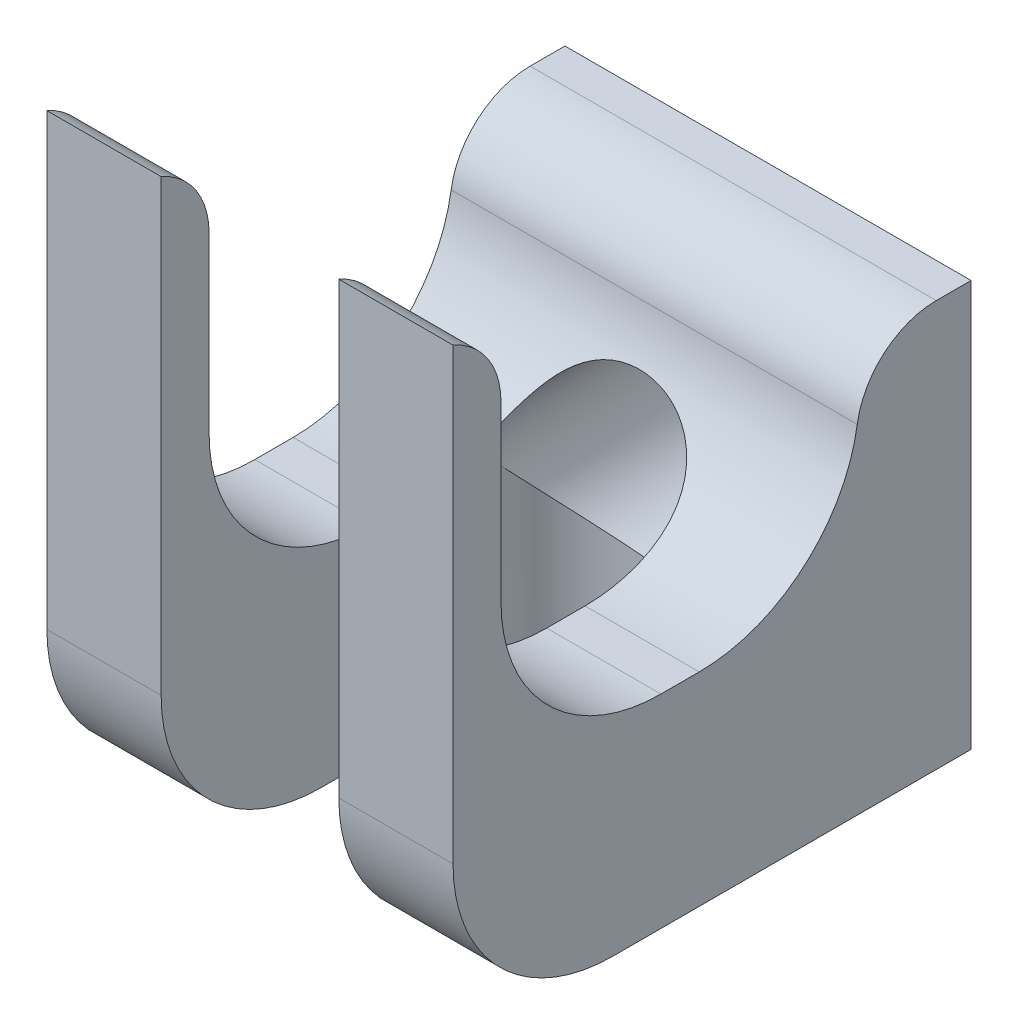
from build123d import *

# Parameters (mm, degrees)
SKETCH1_W                                        = 25.4
SKETCH1_H                                        = 25.4
BOSS_EXTRUDE1_DEPTH                              = 7
CBORE_FOR_1_4_SOCKET_HEAD_CAP_SCREW1_D           = 6.7564
CBORE_FOR_1_4_SOCKET_HEAD_CAP_SCREW1_CBORE_D     = 11.1125
CBORE_FOR_1_4_SOCKET_HEAD_CAP_SCREW1_CBORE_DEPTH = 6.35
SKETCH4_W                                        = 7.14375
SKETCH4_H                                        = 12.7
BOSS_EXTRUDE2_DEPTH                              = 25.4
SKETCH5_W                                        = 7.14375
SKETCH5_H                                        = 3
BOSS_EXTRUDE3_DEPTH                              = 25.4
FILLET1_R                                        = 10
FILLET2_START                                    = -14
FILLET2_DEPTH                                    = 28
FILLET2_START_2                                  = -12.7
FILLET2_2_DEPTH                                  = 12.604348727
FILLET2_START_3                                  = 7
FILLET2_3_DEPTH                                  = 10.0000001


with BuildPart() as part:
    # Sketch1 → Boss-Extrude1 (new body)
    with BuildSketch(Plane.XY):
        Rectangle(SKETCH1_W, SKETCH1_H)
    extrude(amount=BOSS_EXTRUDE1_DEPTH)

    # CBORE for 1/4 Socket Head Cap Screw1 (through all)
    with Locations(Plane.XY.offset(7)):
        with Locations((0, 0)):
            CounterBoreHole(CBORE_FOR_1_4_SOCKET_HEAD_CAP_SCREW1_D / 2, CBORE_FOR_1_4_SOCKET_HEAD_CAP_SCREW1_CBORE_D / 2, CBORE_FOR_1_4_SOCKET_HEAD_CAP_SCREW1_CBORE_DEPTH)

    # Sketch4 → Boss-Extrude2 (add)
    with BuildSketch(Plane.XY.offset(7)):
        with Locations((-9.128125, -6.35)):
            Rectangle(SKETCH4_W, SKETCH4_H)
        with Locations((9.128125, -6.35)):
            Rectangle(SKETCH4_W, SKETCH4_H)
    extrude(amount=BOSS_EXTRUDE2_DEPTH)

    # Sketch5 → Boss-Extrude3 (add)
    with BuildSketch(Plane(origin=(0, 0, 0), x_dir=(1, 0, 0), z_dir=(0, 1, 0))):
        with Locations((-9.128125, -30.9)):
            Rectangle(SKETCH5_W, SKETCH5_H)
        with Locations((9.128125, -30.9)):
            Rectangle(SKETCH5_W, SKETCH5_H)
    extrude(amount=BOSS_EXTRUDE3_DEPTH)

    # Fillet1
    # the kernel refuses this fillet: 10 mm, written as the material it adds along each edge
    with BuildSketch(Plane(origin=(-19.44375, 0, 7), x_dir=(0, 1, 0), z_dir=(1, 0, 0))) as fillet1_piece_1_section:
        with BuildLine():
            CenterArc((FILLET1_R, FILLET1_R), FILLET1_R, 180, 90)
            Line((0, FILLET1_R), (0, 0))
            Line((0, 0), (FILLET1_R, 0))
        make_face()
    fillet1_piece_1 = extrude(amount=32.14375, mode=Mode.PRIVATE)
    fillet1_piece_1 = fillet1_piece_1 - Plane(origin=(0, 0, 7), x_dir=(1, 0, 0), z_dir=(0, 0, 1)) * Cylinder(5.55625, 105, mode=Mode.PRIVATE)
    fillet1_piece_1 = split(fillet1_piece_1, bisect_by=Plane(origin=(-12.7, 0, 7), z_dir=(1, 0, 0)), keep=Keep.TOP, mode=Mode.PRIVATE)
    add(fillet1_piece_1)
    with BuildSketch(Plane(origin=(-12.7, 0, 29.4), x_dir=(0, 0, -1), z_dir=(1, 0, 0))) as fillet1_piece_2:
        with BuildLine():
            CenterArc((FILLET1_R, FILLET1_R), FILLET1_R, 180, 90)
            Line((0, FILLET1_R), (0, 0))
            Line((0, 0), (FILLET1_R, 0))
        make_face()
    extrude(amount=7.14375)
    with BuildSketch(Plane(origin=(-37.7, 0, 29.4), x_dir=(0, 0, -1), z_dir=(1, 0, 0))) as fillet1_piece_3_section:
        with BuildLine():
            CenterArc((FILLET1_R, FILLET1_R), FILLET1_R, 180, 90)
            Line((0, FILLET1_R), (0, 0))
            Line((0, 0), (FILLET1_R, 0))
        make_face()
    fillet1_piece_3 = extrude(amount=57.14375, mode=Mode.PRIVATE)
    fillet1_piece_3 = split(fillet1_piece_3, bisect_by=Plane(origin=(5.55625, 0, 29.4), z_dir=(1, 0, 0)), keep=Keep.TOP, mode=Mode.PRIVATE)
    fillet1_piece_3 = split(fillet1_piece_3, bisect_by=Plane(origin=(12.7, 0, 29.4), z_dir=(-1, 0, 0)), keep=Keep.TOP, mode=Mode.PRIVATE)
    add(fillet1_piece_3)
    with BuildSketch(Plane(origin=(12.7, 0, 29.4), x_dir=(0, 0, -1), z_dir=(-1, 0, 0))) as fillet1_piece_4:
        with BuildLine():
            CenterArc((FILLET1_R, -FILLET1_R), FILLET1_R, 90, 90)
            Line((0, -FILLET1_R), (0, 0))
            Line((0, 0), (FILLET1_R, 0))
        make_face()
    extrude(amount=7.14375)
    with BuildSketch(Plane(origin=(37.7, 0, 29.4), x_dir=(0, 0, -1), z_dir=(-1, 0, 0))) as fillet1_piece_5_section:
        with BuildLine():
            CenterArc((FILLET1_R, -FILLET1_R), FILLET1_R, 90, 90)
            Line((0, -FILLET1_R), (0, 0))
            Line((0, 0), (FILLET1_R, 0))
        make_face()
    fillet1_piece_5 = extrude(amount=57.14375, mode=Mode.PRIVATE)
    fillet1_piece_5 = split(fillet1_piece_5, bisect_by=Plane(origin=(-12.7, 0, 29.4), z_dir=(1, 0, 0)), keep=Keep.TOP, mode=Mode.PRIVATE)
    fillet1_piece_5 = split(fillet1_piece_5, bisect_by=Plane(origin=(-5.55625, 0, 29.4), z_dir=(-1, 0, 0)), keep=Keep.TOP, mode=Mode.PRIVATE)
    add(fillet1_piece_5)
    # the kernel refuses this fillet: 10 mm, written as the material it takes off along each edge
    with BuildSketch(Plane(origin=(-37.7, -12.7, 32.4), x_dir=(0, 0, -1), z_dir=(1, 0, 0))) as fillet1_2_piece_1:
        with BuildLine():
            CenterArc((FILLET1_R, FILLET1_R), FILLET1_R, 180, 90)
            Line((0, FILLET1_R), (0, 0))
            Line((0, 0), (FILLET1_R, 0))
        make_face()
    extrude(amount=57.14375, mode=Mode.SUBTRACT)
    with BuildSketch(Plane(origin=(37.7, -12.7, 32.4), x_dir=(0, 0, -1), z_dir=(-1, 0, 0))) as fillet1_2_piece_2:
        with BuildLine():
            CenterArc((FILLET1_R, -FILLET1_R), FILLET1_R, 90, 90)
            Line((0, -FILLET1_R), (0, 0))
            Line((0, 0), (FILLET1_R, 0))
        make_face()
    extrude(amount=57.14375, mode=Mode.SUBTRACT)

    # Fillet2: read off the stored shape, not the designer's step
    # Fillet2 outline → Fillet2 (cut)
    with BuildSketch(Plane.YZ.offset(FILLET2_START)):
        with BuildLine():
            ThreePointArc((10, 7), (9.231056683, 7.029607521), (8.466666667, 7.118254765))
            ThreePointArc((8.466666667, 7.118254765), (11.496928583, 5.430585697), (12.7, 2.177382148))
            Line((12.7, 2.177382148), (12.7, 7))
            Line((12.7, 7), (10, 7))
        make_face()
        with BuildLine():
            Line((25.4, 29.4), (25.4, 32.4))
            ThreePointArc((25.4, 32.4), (23.556037093, 30.216699867), (20.817424305, 29.4))
            Line((20.817424305, 29.4), (25.4, 29.4))
        make_face()
    extrude(amount=FILLET2_DEPTH, mode=Mode.SUBTRACT)

    # Fillet2 2 outline → Fillet2 2 (add)
    with BuildSketch(Plane(origin=(0, 0, 0), x_dir=(1, 0, 0), z_dir=(0, 1, 0)).offset(FILLET2_START_2)):
        with BuildLine():
            Line((5.55625, -7), (0.55625, -7))
            ThreePointArc((0.55625, -7), (4.091783906, -8.464466094), (5.55625, -12))
            Line((5.55625, -12), (5.55625, -7))
        make_face()
        with BuildLine():
            ThreePointArc((-5.55625, -12), (-4.091783906, -8.464466094), (-0.55625, -7))
            Line((-0.55625, -7), (-5.55625, -7))
            Line((-5.55625, -7), (-5.55625, -12))
        make_face()
    extrude(amount=FILLET2_2_DEPTH)

    # Fillet2 3 outline → Fillet2 3 (cut)
    with BuildSketch(Plane.XY.offset(FILLET2_START_3)):
        with BuildLine():
            ThreePointArc((5.555426617, -0.095651273), (0, 5.55625), (-5.555426617, -0.095651273))
            ThreePointArc((-5.555426617, -0.095651273), (0, -5.55625), (5.555426617, -0.095651273))
        make_face()
    extrude(amount=FILLET2_3_DEPTH, mode=Mode.SUBTRACT)


solid = part.part
